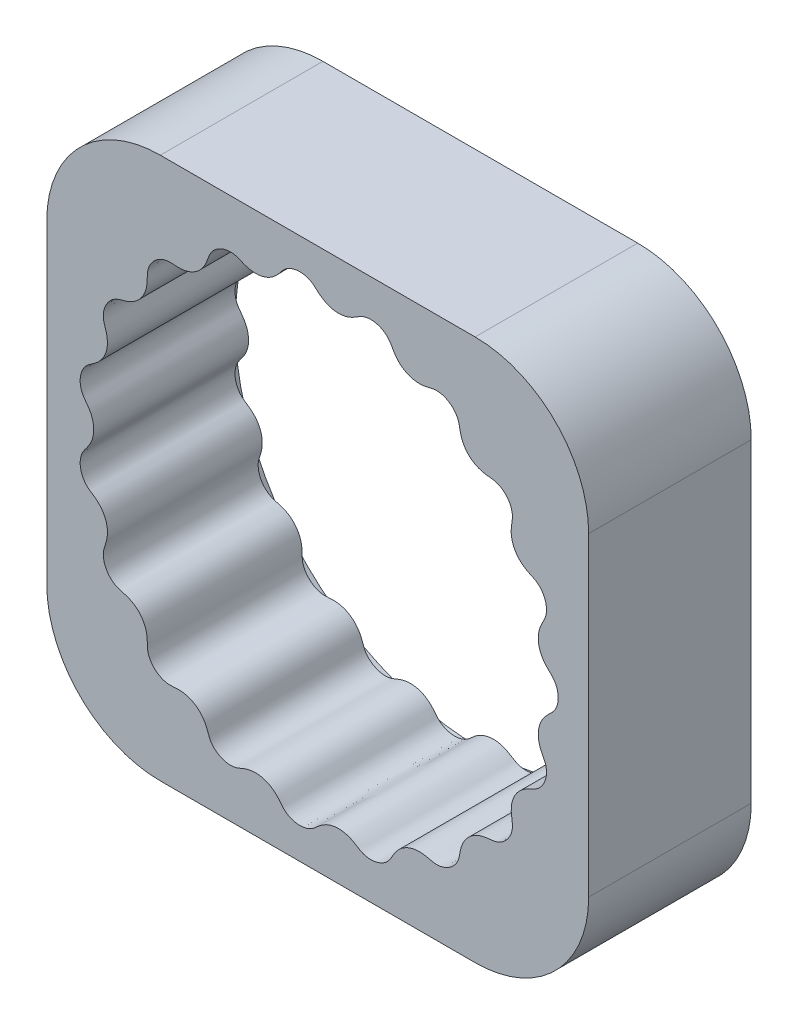
from build123d import *

# Parameters (mm, degrees)
BOSS_EXTRUDE1_START     = -15
BOSS_EXTRUDE1_OUTLINE_W = 105
BOSS_EXTRUDE1_OUTLINE_H = 105
BOSS_EXTRUDE1_DEPTH     = 30
FILLET1_R               = 22
SKETCH3_R               = 47.5
BOSS_EXTRUDE2_DEPTH     = 1.5


# Read off the part's stored shape, not the designer's step: Boss-Extrude1
with BuildPart() as part:
    # Boss-Extrude1 outline → Boss-Extrude1 (new body)
    with BuildSketch(Plane.XY.offset(BOSS_EXTRUDE1_START)):
        Rectangle(BOSS_EXTRUDE1_OUTLINE_W, BOSS_EXTRUDE1_OUTLINE_H)
        with BuildLine():
            add(Edge.make_bspline(
                [(46.6, 0), (46.6, 0.029087461), (46.599364612, 0.087257129), (46.596505374, 0.189641599), (46.588879748, 0.333882329), (46.577439121, 0.472245688), (46.562181605, 0.604872273), (46.543105311, 0.736757111), (46.520205715, 0.869043535), (46.486793745, 1.034170725), (46.439000291, 1.230350248), (46.353070581, 1.520585204), (46.187608886, 1.948385058), (45.914553276, 2.462387961), (45.539034763, 2.944331255), (45.129326083, 3.33695268), (44.714883503, 3.72361592), (44.198622495, 4.235491045), (43.580390842, 5.003267586), (43.019635917, 6.085802978), (42.70540379, 7.399867904), (42.709511206, 8.517145629), (42.869182264, 9.382721248), (43.072025934, 10.026910788), (43.246298223, 10.466491915), (43.448090078, 10.894056312), (43.668303415, 11.312056785), (43.890460635, 11.729115857), (44.081486543, 12.162206318), (44.230509691, 12.646282797), (44.322254654, 13.17793841), (44.350269351, 13.901303309), (44.225980004, 14.785484309), (43.876469959, 15.753952549), (43.328261092, 16.571354837), (42.768276951, 17.118887669), (42.275218646, 17.463336276), (41.905394974, 17.668576571), (41.521608513, 17.845226332), (41.135800326, 18.016913299), (40.659736215, 18.245477721), (40.000488409, 18.617770316), (39.211352323, 19.215530447), (38.390031463, 20.155740794), (37.755372598, 21.401023427), (37.481291974, 22.6293171), (37.470138146, 23.643544264), (37.553204291, 24.3880984), (37.628385857, 24.871024236), (37.689307277, 25.25722304), (37.742949817, 25.743362292), (37.736273109, 26.407348831), (37.569014003, 27.23186091), (37.142972639, 28.180724435), (36.537210357, 28.966027778), (35.883456351, 29.532147771), (35.277085835, 29.895071779), (34.793981515, 30.10527269), (34.319162875, 30.244730454), (33.863161615, 30.323576928), (33.40313321, 30.366596235), (32.943171832, 30.408516422), (32.484935629, 30.468628109), (32.03098993, 30.556165837), (31.349481898, 30.737428845), (30.468549449, 31.097990168), (29.517636227, 31.727587687), (28.726402343, 32.591405442), (28.227269822, 33.404807425), (27.928053926, 34.083475509), (27.741981913, 34.646648529), (27.621495158, 35.151246838), (27.540892191, 35.588105319), (27.46407256, 36.025537396), (27.369150784, 36.504337733), (27.180106222, 37.082688092), (26.833292886, 37.722160757), (26.352791657, 38.324287786), (25.720738212, 38.890346654), (24.928043822, 39.373543485), (24.047894654, 39.686381568), (23.215360253, 39.78729997), (22.554927394, 39.741939088), (22.076027287, 39.650264034), (21.697241263, 39.55831848), (21.223758534, 39.443418722), (20.491270286, 39.297697162), (19.483061541, 39.221365323), (18.237383811, 39.38671866), (16.9412821, 39.909449178), (15.931398173, 40.646304358), (15.265420547, 41.382957669), (14.836701001, 42.009807629), (14.567886647, 42.466205551), (14.364116276, 42.8375367), (14.156406596, 43.206851773), (13.92202596, 43.560461381), (13.629057317, 43.916130741), (13.27011591, 44.260374073), (12.727767821, 44.664759759), (11.948159371, 45.061481341), (11.09271343, 45.294077816), (10.202357254, 45.34680237), (9.485549687, 45.261338322), (8.964345806, 45.12813622), (8.494853492, 44.941959947), (8.079335521, 44.71804952), (7.68280732, 44.463457476), (7.285877828, 44.209748252), (6.878169469, 43.97304101), (6.456372041, 43.762329426), (5.833872308, 43.505386686), (4.987909175, 43.271745962), (3.876320491, 43.169819966), (2.539162677, 43.367535142), (1.409790188, 43.832381738), (0.588840645, 44.384000745), (0.033206999, 44.856327151), (-0.317522366, 45.17488567), (-0.600518674, 45.427162793), (-0.972085052, 45.721875048), (-1.527217323, 46.062503501), (-2.303235928, 46.359067305), (-3.298726206, 46.505710733), (-4.380312925, 46.418186837), (-5.336697925, 46.114804242), (-6.051490182, 45.701544497), (-6.543432506, 45.28061924), (-6.862182092, 44.93308185), (-7.099467465, 44.640145681), (-7.390965094, 44.270087148), (-7.85580291, 43.714144886), (-8.564983, 43.034238721), (-9.645305925, 42.348851824), (-11.053671018, 41.900713757), (-12.399361948, 41.847716086), (-13.477212764, 42.054859944), (-14.248747763, 42.321200786), (-14.748329849, 42.528078612), (-15.144725128, 42.700651944), (-15.54804898, 42.857976029), (-15.964827464, 42.976465966), (-16.424561869, 43.054831219), (-16.923509929, 43.080933138), (-17.596231206, 43.034608683), (-18.424859211, 42.836591729), (-19.330531401, 42.418208159), (-20.084149678, 41.819645132), (-20.583925648, 41.219723741), (-20.887529946, 40.702592125), (-21.062460409, 40.318882171), (-21.207179109, 39.923272014), (-21.345795171, 39.525730848), (-21.532751901, 39.033537922), (-21.846234916, 38.346942265), (-22.371718452, 37.51158873), (-23.235224483, 36.612351462), (-24.420037522, 35.870640193), (-25.621445103, 35.489625147), (-26.634100057, 35.390458765), (-27.385338694, 35.409912071), (-27.874415543, 35.444435486), (-28.265423903, 35.473940863), (-28.657808638, 35.485591011), (-29.049922684, 35.462778276), (-29.609443499, 35.375052303), (-30.317114974, 35.149276757), (-31.143352348, 34.695078612), (-31.877513229, 34.027785471), (-32.388692105, 33.331175607), (-32.701134403, 32.699553889), (-32.871878953, 32.202639001), (-32.97315823, 31.719649794), (-33.015706635, 31.260070917), (-33.021315439, 30.799307278), (-33.02466199, 30.338714031), (-33.045665963, 29.878295211), (-33.093911831, 29.419780471), (-33.215495563, 28.727116861), (-33.497441819, 27.820770261), (-34.040704398, 26.819690287), (-34.831315921, 25.956095904), (-35.598629525, 25.387101875), (-36.250805729, 25.028894083), (-36.797567632, 24.794179621), (-37.291610194, 24.630493146), (-37.721505444, 24.513048501), (-38.152484082, 24.400066194), (-38.623629338, 24.266873639), (-39.187164279, 24.032432169), (-39.799081301, 23.634769785), (-40.36260276, 23.106034759), (-40.876472492, 22.429627339), (-41.293889066, 21.600960829), (-41.534535207, 20.700182313), (-41.568863522, 19.864910481), (-41.472077943, 19.212101178), (-41.343195847, 18.743379247), (-41.221082694, 18.374466146), (-41.067537268, 17.913659669), (-40.860647334, 17.198463746), (-40.697949644, 16.20379394), (-40.752236204, 14.982678894), (-41.130058644, 13.706086002), (-41.724378981, 12.666920056), (-42.346630019, 11.949944985), (-42.914545599, 11.453911918), (-43.36570477, 11.12002078), (-43.737705228, 10.868799961), (-44.112515882, 10.621938918), (-44.473001401, 10.353649668), (-44.937026241, 9.925564315), (-45.432780332, 9.276484551), (-45.85982989, 8.361475204), (-46.054645226, 7.332730317), (-46.035304424, 6.433680211), (-45.893339269, 5.728053082), (-45.719711363, 5.220475217), (-45.497784051, 4.768435111), (-45.242562272, 4.372936441), (-44.95746402, 3.999425043), (-44.672243636, 3.626196511), (-44.40255798, 3.241183513), (-44.157159078, 2.84014718), (-43.848370672, 2.243882141), (-43.542926044, 1.423779601), (-43.349852638, 0.35773357), (-43.41587872, -0.928193685), (-43.73968724, -2.052127744), (-44.170903187, -2.895110464), (-44.576050773, -3.495305807), (-44.879637417, -3.89865098), (-45.126068462, -4.218516436), (-45.35995448, -4.5481038), (-45.564196947, -4.897255034), (-45.748344007, -5.300034028), (-45.898352022, -5.757510539), (-46.028291706, -6.404246465), (-46.056011502, -7.232679593), (-45.90360822, -8.181146762), (-45.52189926, -9.116043895), (-45.054559895, -9.793605367), (-44.597609809, -10.24958302), (-44.227060272, -10.539109333), (-43.916808035, -10.751390924), (-43.52497417, -11.010478179), (-42.933523203, -11.425186638), (-42.197462177, -12.070967255), (-41.440263105, -13.061334193), (-40.885173083, -14.362848438), (-40.692886921, -15.644152631), (-40.767518554, -16.697924706), (-40.942569439, -17.489922394), (-41.107078592, -18.036262169), (-41.253264472, -18.468374312), (-41.393334913, -18.902831626), (-41.495247263, -19.348527803), (-41.549342916, -19.834203374), (-41.543240717, -20.354477429), (-41.447101521, -21.045513367), (-41.182339935, -21.872942564), (-40.688480135, -22.753100501), (-40.026775362, -23.461012396), (-39.390948583, -23.910155699), (-38.853107879, -24.171270732), (-38.457982178, -24.314997399), (-38.053197956, -24.42708195), (-37.64675139, -24.531900087), (-37.142038149, -24.676194717), (-36.433328318, -24.928930554), (-35.558308552, -25.37866609), (-34.612604024, -26.139482406), (-33.800095265, -27.197967509), (-33.310413145, -28.303671653), (-33.100747534, -29.256890066), (-33.035961406, -30.000647108), (-33.022448287, -30.521436434), (-33.020934216, -30.93802916), (-33.009240784, -31.354767139), (-32.963258516, -31.769568685), (-32.867143359, -32.212481315), (-32.70932044, -32.675502609), (-32.420302687, -33.274873428), (-31.925261302, -33.974666151), (-31.293487791, -34.568413067), (-30.55221464, -35.025449505), (-29.899465003, -35.285698973), (-29.391987449, -35.416124968), (-28.903859788, -35.478809394), (-28.443598193, -35.485005889), (-27.985109803, -35.453423757), (-27.527108489, -35.418415053), (-27.067822527, -35.400390013), (-26.608126306, -35.409213019), (-25.909508979, -35.47055211), (-24.98474332, -35.672196203), (-24.058287402, -36.074386773), (-23.195282906, -36.694531458), (-22.580291821, -37.315387153), (-22.157905423, -37.859866122), (-21.794223425, -38.462181376), (-21.532014308, -39.028926658), (-21.340816844, -39.539132067), (-21.187475413, -39.979029037), (-21.056859249, -40.328370888), (-20.864525811, -40.753337701), (-20.531775511, -41.300446627), (-19.989267547, -41.910606678), (-19.186680674, -42.495885748), (-18.198742075, -42.920563184), (-17.211451966, -43.100880124), (-16.378692256, -43.068800628), (-15.737516589, -42.921511161), (-15.281814566, -42.756475638), (-14.925149692, -42.60523728), (-14.480127692, -42.414385226), (-13.787294208, -42.148238149), (-12.813514375, -41.900951627), (-11.610585016, -41.8490742), (-10.337588254, -42.101694414), (-9.371648719, -42.533226002), (-8.689955807, -42.983804945), (-8.196993057, -43.400015536), (-7.857883944, -43.732357261), (-7.541689551, -44.086448454), (-7.243389355, -44.455410771), (-6.951486554, -44.829275853), (-6.637732453, -45.186083686), (-6.161065809, -45.618271953), (-5.471404128, -46.052289652), (-4.531729166, -46.394678261), (-3.506503098, -46.501851967), (-2.620959945, -46.411145903), (-1.930900495, -46.213866602), (-1.440101883, -46.001165413), (-1.008199144, -45.745055861), (-0.635068333, -45.460312519), (-0.286844081, -45.146791783), (0.060207743, -44.832270735), (0.419910008, -44.531752914), (0.797329731, -44.25367963), (1.363115268, -43.89565228), (2.151225627, -43.521133486), (3.069293267, -43.270129879), (4.090579929, -43.200885347), (4.980606689, -43.29020225), (5.727321282, -43.469288679), (6.350058033, -43.707681041), (6.855325115, -43.960392245), (7.256207697, -44.193670366), (7.56371739, -44.386746445), (7.868672957, -44.583634275), (8.178964683, -44.772524983), (8.582222823, -44.981743841), (9.166600108, -45.201750997), (9.949755718, -45.347735369), (10.923921168, -45.323373972), (11.952107252, -45.065605809), (12.833911886, -44.619777654), (13.470166718, -44.101700977), (13.887500425, -43.61186031), (14.146152239, -43.220867431), (14.332190277, -42.895531723), (14.557243566, -42.484873602), (14.919162012, -41.862371902), (15.497147725, -41.075873712), (16.4161953, -40.236326862), (17.663787326, -39.569177797), (18.924969634, -39.265079517), (19.984296654, -39.248036928), (20.790665402, -39.354825599), (21.350506246, -39.472829745), (21.794510371, -39.582831296), (22.240028089, -39.68772929), (22.693582681, -39.754434092), (23.183377617, -39.770095592), (23.702981116, -39.722604435), (24.386071642, -39.571145789), (25.190286121, -39.240311492), (26.027383048, -38.677318298), (26.678987062, -37.961788991), (27.074960175, -37.294299359), (27.292215643, -36.739219006), (27.404045113, -36.335200727), (27.483006235, -35.92392845), (27.553549291, -35.511428803), (27.654424697, -34.997885182), (27.844965155, -34.272385809), (28.216031148, -33.364564212), (28.890156642, -32.357356991), (29.873150236, -31.454965885), (30.93330336, -30.86952139), (31.867741284, -30.577154216), (32.605510667, -30.448558397), (33.124863271, -30.391003117), (33.541144212, -30.354903797), (33.956818374, -30.309694973), (34.367931711, -30.230977638), (34.803195622, -30.099848837), (35.253601598, -29.90522522), (35.829727895, -29.568264887), (36.488107619, -29.017933528), (37.028982636, -28.340300749), (37.42448219, -27.565387247), (37.631175985, -26.895822302), (37.720680075, -26.381032737), (37.744597382, -25.890842805), (37.714613789, -25.432758415), (37.646300663, -24.979522235), (37.573425558, -24.527290993), (37.516725603, -24.072414827), (37.486293382, -23.614930216), (37.487260776, -22.915541514), (37.607562747, -21.979511393), (37.981612168, -20.85779432), (38.75276426, -19.671691071), (39.666787707, -18.828038809), (40.49797482, -18.319456761), (41.147514954, -18.011443702), (41.574633246, -17.821431654), (41.913461312, -17.662773755), (42.323315352, -17.436839115), (42.844274796, -17.060923449), (43.411203534, -16.469707776), (43.926938672, -15.627817301), (44.267717023, -14.624106896), (44.371412297, -13.654409652), (44.289189571, -12.86067167), (44.116674888, -12.259464523), (43.940306734, -11.83997082), (43.777015952, -11.514793846), (43.562751259, -11.113971502), (43.309988076, -10.619280631), (43.05517887, -10.013283664), (42.844797238, -9.283975605), (42.729731478, -8.52355349), (42.715951334, -7.579290135), (42.900450934, -6.470843349), (43.332715359, -5.412563918), (43.929519137, -4.551669803), (44.45547596, -3.977875104), (44.82489899, -3.620051543), (45.126415876, -3.340387906), (45.421283365, -3.053265717), (45.69235234, -2.743053666), (45.950494641, -2.378605209), (46.149409688, -2.017298355), (46.298553136, -1.66994977), (46.396529934, -1.377009003), (46.451827543, -1.178574091), (46.491256037, -1.01123335), (46.518796895, -0.876853704), (46.542321479, -0.742815133), (46.561861492, -0.608228856), (46.577557899, -0.468108615), (46.589452906, -0.321119434), (46.595248795, -0.216114461), (46.597500878, -0.156808149), (46.598296327, -0.127135709)],
                knots=[0.067476216, 0.067476216, 0.067476216, 0.067476216, 0.067476216, 0.067844778, 0.06821334, 0.068581902, 0.068950464, 0.069319026, 0.069687588, 0.07005615, 0.070424712, 0.071161836, 0.07189896, 0.073373208, 0.075444729, 0.077516251, 0.078552011, 0.079587772, 0.081659293, 0.085482409, 0.089305525, 0.092815775, 0.096326026, 0.097620812, 0.098915599, 0.100210386, 0.101505173, 0.10279996, 0.104094747, 0.105389533, 0.10668432, 0.108337983, 0.109991645, 0.11329897, 0.116406241, 0.119513511, 0.120670895, 0.121828278, 0.122985661, 0.124143044, 0.125300428, 0.126457811, 0.128772577, 0.132431495, 0.136090414, 0.14001233, 0.143934247, 0.146077059, 0.147148466, 0.148219872, 0.149291278, 0.150362685, 0.152505497, 0.155469761, 0.158434024, 0.161661995, 0.163275981, 0.164889966, 0.166155807, 0.167421649, 0.16868749, 0.169953331, 0.171219172, 0.172485013, 0.173750854, 0.175016695, 0.178942369, 0.182868043, 0.186114094, 0.18773712, 0.189360146, 0.190983171, 0.192606197, 0.19341771, 0.194229223, 0.195852249, 0.197953333, 0.200054417, 0.202155501, 0.204256585, 0.207211813, 0.210167041, 0.212303246, 0.213371348, 0.214439451, 0.215507554, 0.216575656, 0.218711861, 0.222621737, 0.226531614, 0.230201837, 0.233872061, 0.23619377, 0.237354625, 0.238515479, 0.239676334, 0.240837188, 0.241998043, 0.243158898, 0.244717084, 0.24627527, 0.249391642, 0.252689694, 0.254338719, 0.255987745, 0.257278834, 0.258569922, 0.259861011, 0.261152099, 0.262443188, 0.263734276, 0.265025365, 0.266316453, 0.269816729, 0.273317005, 0.277153187, 0.280989369, 0.283066851, 0.284105593, 0.285144334, 0.286183075, 0.287221816, 0.289299299, 0.292256842, 0.295214385, 0.298153847, 0.301093309, 0.303158909, 0.30419171, 0.30522451, 0.30625731, 0.30729011, 0.30935571, 0.313165725, 0.31697574, 0.321172792, 0.325369844, 0.327740076, 0.328925192, 0.330110308, 0.331295425, 0.332480541, 0.333665657, 0.334850773, 0.336397317, 0.33794386, 0.341036948, 0.344135088, 0.347233227, 0.348387151, 0.349541074, 0.350694997, 0.351848921, 0.353002844, 0.354156767, 0.356464614, 0.360112192, 0.36375977, 0.367693703, 0.371627635, 0.373777085, 0.37485181, 0.375926534, 0.377001259, 0.378075984, 0.379150709, 0.380225434, 0.383198716, 0.386171998, 0.389391084, 0.391000627, 0.39261017, 0.393872574, 0.395134978, 0.396397382, 0.397659786, 0.39892219, 0.400184594, 0.401446998, 0.402709403, 0.406624153, 0.410538904, 0.41379527, 0.415423454, 0.417051637, 0.418679821, 0.420308004, 0.421122096, 0.421936187, 0.423564371, 0.425671917, 0.427779464, 0.429887011, 0.431994558, 0.434940736, 0.437886914, 0.440016543, 0.441081358, 0.442146172, 0.443210987, 0.444275801, 0.44640543, 0.450303242, 0.454201053, 0.457531125, 0.460861197, 0.463321098, 0.464551048, 0.465780999, 0.467010949, 0.4682409, 0.46947085, 0.4707008, 0.47391528, 0.47712976, 0.480418499, 0.482062869, 0.483707238, 0.484994631, 0.486282023, 0.487569416, 0.488856808, 0.490144201, 0.491431593, 0.492718986, 0.494006378, 0.497496655, 0.500986931, 0.504491141, 0.507995351, 0.51020864, 0.511315284, 0.512421929, 0.513528573, 0.514635217, 0.515741862, 0.516848506, 0.518374532, 0.519900559, 0.522952611, 0.525883037, 0.528813462, 0.530873193, 0.531903058, 0.532932923, 0.533962788, 0.534992653, 0.537052383, 0.540849262, 0.544646141, 0.548521961, 0.552397781, 0.554898446, 0.556148779, 0.557399111, 0.558649443, 0.559899776, 0.561150108, 0.562400441, 0.563994159, 0.565587878, 0.568775315, 0.571864297, 0.574953278, 0.576103754, 0.577254229, 0.578404705, 0.579555181, 0.580705656, 0.581856132, 0.584157083, 0.587793287, 0.591429492, 0.595036866, 0.59864424, 0.600927916, 0.602069755, 0.603211593, 0.604353431, 0.605495269, 0.606637107, 0.607778946, 0.609311832, 0.610844718, 0.61391049, 0.617120645, 0.618725722, 0.6203308, 0.621589771, 0.622848742, 0.624107712, 0.625366683, 0.626625654, 0.627884625, 0.629143596, 0.630402567, 0.634306336, 0.638210106, 0.640094005, 0.641977905, 0.643861805, 0.645745704, 0.647788764, 0.648810294, 0.649831824, 0.650853354, 0.651874883, 0.653917943, 0.656825574, 0.659733204, 0.662670319, 0.665607435, 0.667730522, 0.668792065, 0.669853608, 0.670915152, 0.671976695, 0.674099782, 0.677985502, 0.681871223, 0.685034802, 0.688198381, 0.689498395, 0.690798408, 0.692098422, 0.693398435, 0.694698449, 0.695998462, 0.697298476, 0.698598489, 0.701733373, 0.704868257, 0.708147647, 0.709787342, 0.711427036, 0.712710736, 0.713994435, 0.715278134, 0.716561833, 0.717845533, 0.719129232, 0.720412931, 0.72169663, 0.725176884, 0.728657138, 0.730755052, 0.732852966, 0.73495088, 0.737048794, 0.73804371, 0.739038626, 0.740033543, 0.741028459, 0.742023375, 0.743018291, 0.745008124, 0.74784953, 0.750690936, 0.753612324, 0.756533711, 0.758587037, 0.759613701, 0.760640364, 0.761667027, 0.76269369, 0.764747016, 0.768531899, 0.772316781, 0.776203724, 0.780090667, 0.782598174, 0.783851927, 0.78510568, 0.786359434, 0.787613187, 0.78886694, 0.790120694, 0.791718932, 0.79331717, 0.796513645, 0.799593443, 0.802673241, 0.803820282, 0.804967323, 0.806114364, 0.807261404, 0.808408445, 0.809555486, 0.811849567, 0.815474365, 0.819099164, 0.822717992, 0.82633682, 0.828627324, 0.829772576, 0.830917829, 0.832063081, 0.833208333, 0.834353585, 0.835498837, 0.837036333, 0.838573829, 0.841648821, 0.844850001, 0.846450591, 0.848051181, 0.849306723, 0.850562265, 0.851817807, 0.85307335, 0.854328892, 0.855584434, 0.856839976, 0.858095519, 0.861988249, 0.86588098, 0.869660006, 0.873439032, 0.875488823, 0.876513719, 0.877538615, 0.878563511, 0.879588406, 0.881638198, 0.884554865, 0.887471532, 0.890317551, 0.893163569, 0.895156765, 0.896153363, 0.897149961, 0.898146559, 0.899143157, 0.901136353, 0.903237521, 0.905338689, 0.907439857, 0.909541025, 0.913556011, 0.917570996, 0.919825422, 0.920952635, 0.922079847, 0.92320706, 0.924334273, 0.925461486, 0.926588698, 0.928093135, 0.928845354, 0.929597572, 0.929973681, 0.930349791, 0.9307259, 0.931102009, 0.931478118, 0.931854227, 0.932230337, 0.932606446, 0.932606446, 0.932606446, 0.932606446, 0.932606446], degree=4))
            ThreePointArc((46.6, 0), (46.599574063, -0.063573562), (46.598296327, -0.127135709))
        make_face(mode=Mode.SUBTRACT)
    extrude(amount=BOSS_EXTRUDE1_DEPTH)

    # Fillet1
    fillet1_edges = [part.edges().sort_by_distance(p)[0] for p in [
        (52.5, -52.5, 0),
        (-52.5, -52.5, 0),
        (-52.5, 52.5, 0),
        (52.5, 52.5, 0),
    ]]
    fillet(fillet1_edges, radius=FILLET1_R)

    # Sketch3 → Boss-Extrude2 (add)
    with BuildSketch(Plane(origin=(0, 0, -15), x_dir=(-1, 0, 0), z_dir=(0, 0, -1))):
        with BuildLine():
            Line((-52.5, 30.5), (-52.5, -30.5))
            ThreePointArc((-52.5, -30.5), (-46.056349186, -46.056349186), (-30.5, -52.5))
            Line((-30.5, -52.5), (30.5, -52.5))
            ThreePointArc((30.5, -52.5), (46.056349186, -46.056349186), (52.5, -30.5))
            Line((52.5, -30.5), (52.5, 30.5))
            ThreePointArc((52.5, 30.5), (46.056349186, 46.056349186), (30.5, 52.5))
            Line((30.5, 52.5), (-30.5, 52.5))
            ThreePointArc((-30.5, 52.5), (-46.056349186, 46.056349186), (-52.5, 30.5))
        make_face()
        Circle(SKETCH3_R, mode=Mode.SUBTRACT)
    extrude(amount=BOSS_EXTRUDE2_DEPTH)


solid = part.part
